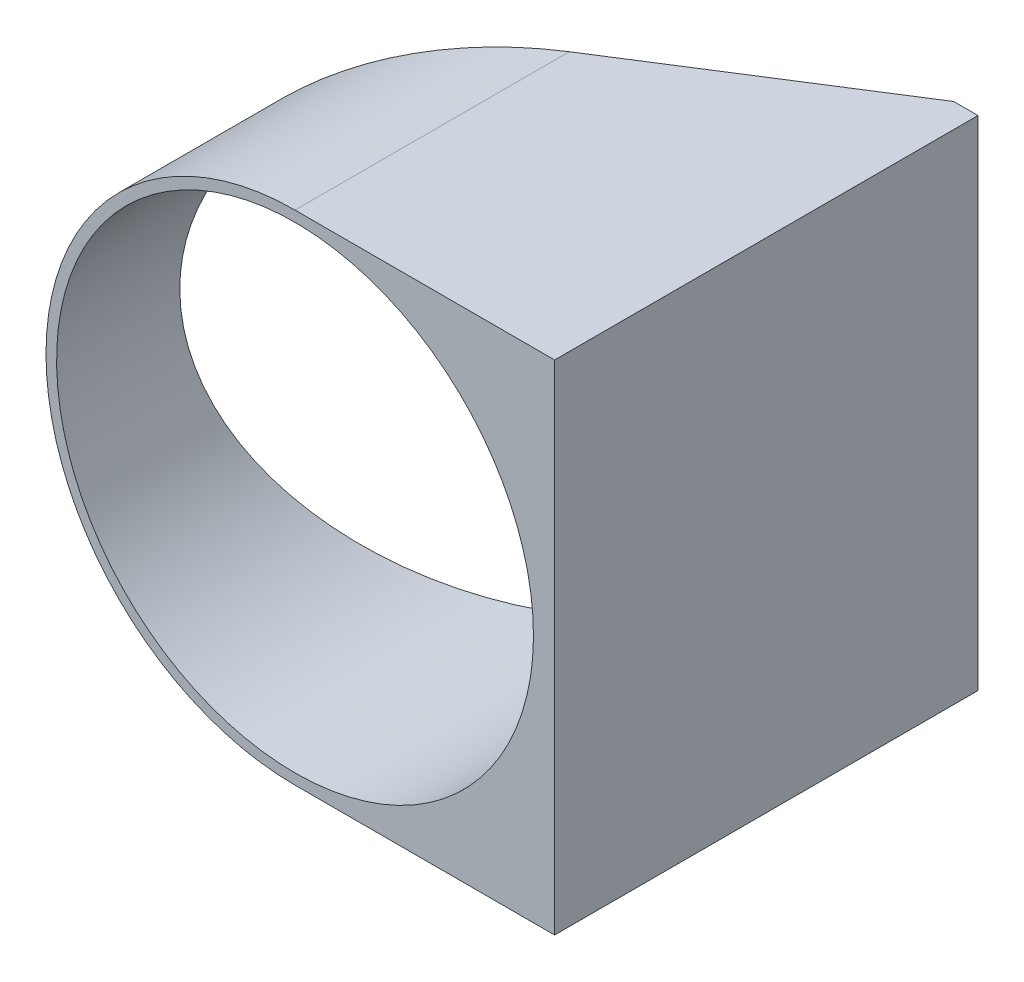
from build123d import *
from OCP.BRepAlgoAPI import BRepAlgoAPI_Cut
from OCP.TopTools import TopTools_ListOfShape

# Parameters (mm, degrees)
BOSS_EXTRUDE1_START     = -559.192741
SKETCH1_R               = 23.525
SKETCH1_R_2             = 22.525
BOSS_EXTRUDE1_DEPTH     = 40.000001
BOSS_EXTRUDE2_START     = -40
BOSS_EXTRUDE2_DEPTH     = 40
CUT_EXTRUDE1_DEPTH      = 730.348205675
CUT_EXTRUDE1_DEPTH_BACK = 730.348205675


with BuildPart() as part:
    # Sketch1 → Boss-Extrude1 (new body)
    with BuildSketch(Plane.XY.offset(BOSS_EXTRUDE1_START)):
        with Locations((443.127496957, 0)):
            Circle(SKETCH1_R)
        with Locations((443.127496957, 0)):
            Circle(SKETCH1_R_2, mode=Mode.SUBTRACT)
    extrude(amount=BOSS_EXTRUDE1_DEPTH)

    # Sketch2 → Boss-Extrude2 (add)
    with BuildSketch(Plane.XY.offset(-519.192740522).offset(BOSS_EXTRUDE2_START)):
        Polygon((466.652496957, -23.525), (467.652496957, -23.525), (467.652496957, 23.525), (466.652496957, 23.525), (466.652496957, 0), align=None)
        with BuildLine():
            Line((466.652496957, 23.525), (443.127496957, 23.525))
            ThreePointArc((443.127496957, 23.525), (459.762183984, 16.634687027), (466.652496957, 0))
            Line((466.652496957, 0), (466.652496957, 23.525))
        make_face()
        with BuildLine():
            Line((466.652496957, -23.525), (466.652496957, 0))
            ThreePointArc((466.652496957, 0), (459.762183984, -16.634687027), (443.127496957, -23.525))
            Line((443.127496957, -23.525), (466.652496957, -23.525))
        make_face()
    extrude(amount=BOSS_EXTRUDE2_DEPTH)


with BuildPart() as cut_extrude1_tool:
    # Sketch3 → Cut-Extrude1 (new, two sides: drawn at the far end of the back side and taken through both)
    with BuildSketch(Plane(origin=(0, 0, 0), x_dir=(1, 0, 0), z_dir=(0, 1, 0)).offset(-CUT_EXTRUDE1_DEPTH_BACK)):
        Polygon((419.602496957, 530.195417764), (465.352496957, 559.192740522), (443.127496957, 559.192740522), (419.602496957, 559.192740522), align=None)
    extrude(amount=CUT_EXTRUDE1_DEPTH + CUT_EXTRUDE1_DEPTH_BACK)


with BuildPart() as part_1:
    add(part.part)

    # Cut-Extrude1: cut by cut_extrude1_tool, with a tolerance
    cut_extrude1_stock = TopTools_ListOfShape()
    cut_extrude1_stock.Append(part_1.part.wrapped)
    cut_extrude1_tools = TopTools_ListOfShape()
    cut_extrude1_tools.Append(cut_extrude1_tool.part.wrapped)
    cut_extrude1_cut = BRepAlgoAPI_Cut()
    cut_extrude1_cut.SetArguments(cut_extrude1_stock)
    cut_extrude1_cut.SetTools(cut_extrude1_tools)
    cut_extrude1_cut.SetFuzzyValue(0.00001)
    cut_extrude1_cut.Build()
    add(Compound.cast(cut_extrude1_cut.Shape()).solids(), mode=Mode.REPLACE)


solid = part_1.part
